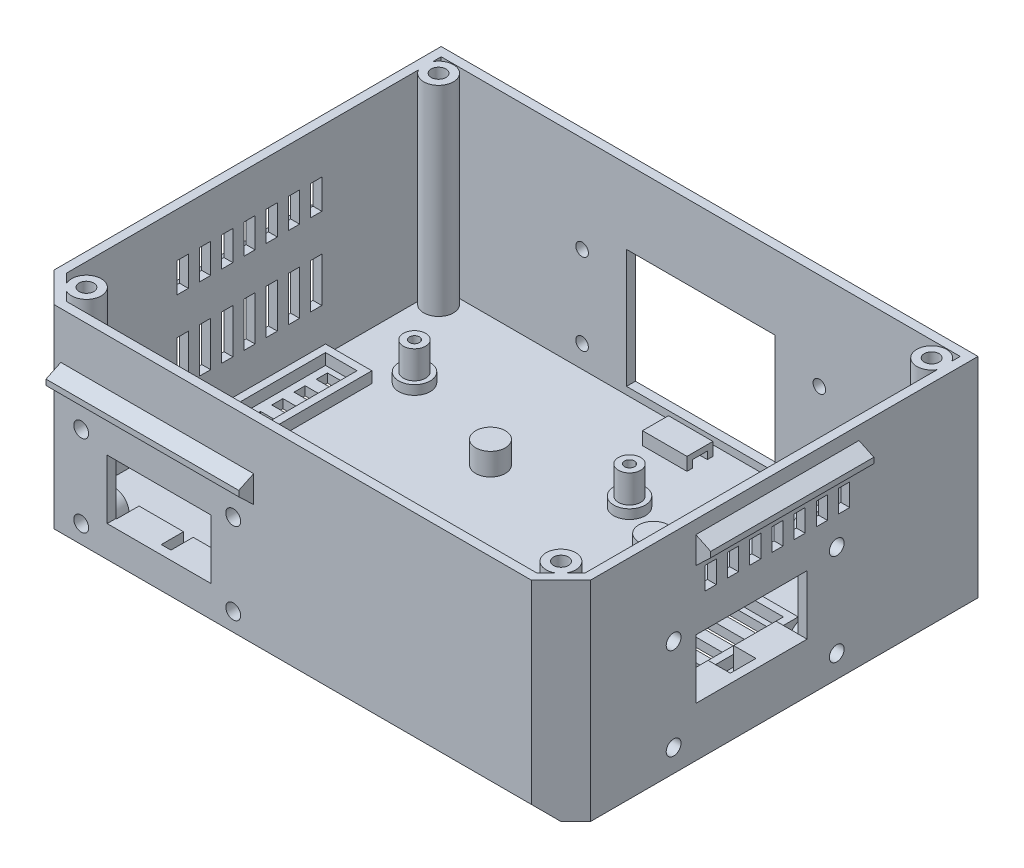
from build123d import *

# Parameters (mm, degrees)
BOX_BLOCK_DEPTH                     = 56.4
REAR_BOTTOM_FACET_DEPTH             = 147.709508894
REAR_BOTTOM_FACET_DEPTH_BACK        = 147.709508894
SHELL_T                             = -2.4
SKETCH3_R                           = 1.7
SKETCH3_W                           = 40
SKETCH3_H                           = 32
CABLE_WINDOW_AND_FLANGE_HOLES_DEPTH = 3.4
SKETCH4_R                           = 3
PI_STANDOFFS_DEPTH                  = 10.5
SKETCH5_R                           = 4.25
PI_STANDOFF_BASES_DEPTH             = 3
SKETCH6_R                           = 1.35
PI_SCREW_HOLES_DEPTH                = 13.4
SKETCH7_R                           = 2.75
PI_COUNTERBORES_DEPTH               = 2.7
SKETCH8_R                           = 4
LID_BOSS_1_DEPTH                    = 54.5
SKETCH9_R                           = 4
LID_BOSS_2_DEPTH                    = 54.5
SKETCH10_R                          = 4
LID_BOSS_3_DEPTH                    = 54.5
SKETCH11_R                          = 4
LID_BOSS_4_DEPTH                    = 54.5
SKETCH12_R                          = 2
LID_INSERT_HOLES_DEPTH              = 6.5
SKETCH13_W                          = 20
SKETCH13_H                          = 40
SKETCH13_W_2                        = 16
SKETCH13_H_2                        = 36
INTAKE_UPSTAND_DEPTH                = 3.5
SKETCH14_W                          = 12
SKETCH14_H                          = 3
INTAKE_SLOTS_DEPTH                  = 3.9
SKETCH15_W                          = 12.5
SKETCH15_H                          = 40
SKETCH15_W_2                        = 8.5
SKETCH15_H_2                        = 36
FLOOR_EXHAUST_UPSTAND_DEPTH         = 3.5
SKETCH16_W                          = 4.5
SKETCH16_H                          = 3
FLOOR_EXHAUST_SLOTS_DEPTH           = 3.9
SKETCH17_W                          = 3
SKETCH17_H                          = 12
EXHAUST_VENTS_DEPTH                 = 3.4
EXHAUST_DRIP_LEDGE_DEPTH            = 44
SKETCH19_W                          = 3
SKETCH19_H                          = 8
UPPER_VENTS_L_DEPTH                 = 3.4
UPPER_DRIP_LEDGE_L_DEPTH            = 44
SKETCH21_W                          = 3
SKETCH21_H                          = 6
UPPER_VENTS_R_DEPTH                 = 3.4
UPPER_DRIP_LEDGE_R_DEPTH            = 44
SKETCH23_W                          = 28
SKETCH23_H                          = 16
REAR_PORT_OPENING_DEPTH             = 3.4
SKETCH24_R                          = 4
REAR_PORT_BOSSES_DEPTH              = 6.6
SKETCH25_W                          = 8
SKETCH25_H                          = 7
REAR_PORT_BOSS_ROOTS_DEPTH          = 6.6
REAR_BOSS_GUSSET_57_DEPTH           = 8
REAR_BOSS_GUSSET_16_DEPTH           = 8
SKETCH28_R                          = 2
REAR_PORT_INSERT_HOLES_DEPTH        = 7
REAR_PORT_DRIP_LEDGE_DEPTH          = 52
SKETCH30_W                          = 12
SKETCH30_H                          = 6.1
REAR_TIE_BLOCK_USBC_DEPTH           = 10.5
SKETCH31_W                          = 3
SKETCH31_H                          = 2
REAR_TIE_TUNNEL_USBC_DEPTH          = 14
SKETCH32_W                          = 12
SKETCH32_H                          = 6.1
REAR_TIE_BLOCK_HDMI_DEPTH           = 10.5
SKETCH33_W                          = 3
SKETCH33_H                          = 2
REAR_TIE_TUNNEL_HDMI_DEPTH          = 14
SKETCH34_W                          = 30
SKETCH34_H                          = 16
SIDE_PORT_OPENING_DEPTH             = 3.4
SKETCH35_R                          = 4
SIDE_PORT_BOSSES_DEPTH              = 6.6
SIDE_BOSS_GUSSET_94_DEPTH           = 8
SIDE_BOSS_GUSSET_50_DEPTH           = 8
SKETCH38_R                          = 2
SIDE_PORT_INSERT_HOLES_DEPTH        = 7
SKETCH39_W                          = 6.1
SKETCH39_H                          = 11.7
SIDE_TIE_BLOCK_ETH_DEPTH            = 11.5
SKETCH40_W                          = 3
SKETCH40_H                          = 2
SIDE_TIE_TUNNEL_ETH_DEPTH           = 14
SKETCH41_W                          = 6.1
SKETCH41_H                          = 11.4
SIDE_TIE_BLOCK_USBA_DEPTH           = 11.5
SKETCH42_W                          = 3
SKETCH42_H                          = 2
SIDE_TIE_TUNNEL_USBA_DEPTH          = 14
SKETCH43_W                          = 12
SKETCH43_H                          = 7
BUNDLE_TIE_ANCHOR_DEPTH             = 4
SKETCH44_W                          = 4
SKETCH44_H                          = 2
BUNDLE_TIE_SLOT_DEPTH               = 14
SKETCH45_R                          = 4
RAIL_PLATE_BOSSES_DEPTH             = 6.5
SKETCH46_R                          = 2
RAIL_INSERT_HOLES_DEPTH             = 6.5


with BuildPart() as part:
    # Sketch1 → Box Block (new body)
    with BuildSketch(Plane(origin=(0, -28.4, 0), x_dir=(1, 0, 0), z_dir=(0, 1, 0))):
        Polygon((-64.4, -124.4), (64.4, -124.4), (72.4, -116.4), (72.4, -11.9), (-72.4, -11.9), (-72.4, -116.4), align=None)
    extrude(amount=BOX_BLOCK_DEPTH)

    # Sketch2 → Rear Bottom Facet (cut, two sides: drawn at the far end of the back side and taken through both)
    with BuildSketch(Plane(origin=(0, 0, 0), x_dir=(0, 0, -1), z_dir=(1, 0, 0)).offset(-REAR_BOTTOM_FACET_DEPTH_BACK)):
        Polygon((-125.4, -23.4), (-119.4, -29.4), (-125.4, -29.4), align=None)
    extrude(amount=REAR_BOTTOM_FACET_DEPTH + REAR_BOTTOM_FACET_DEPTH_BACK, mode=Mode.SUBTRACT)

    # Shell
    shell_openings = [part.faces().sort_by_distance(p)[0] for p in [
        (0, 28, 67.938651958),
    ]]
    offset(amount=SHELL_T, openings=shell_openings, kind=Kind.INTERSECTION)

    # Sketch3 → Cable Window and Flange Holes (cut)
    with BuildSketch(Plane.XY.offset(11.4)):
        with Locations((-32, 2)):
            Circle(SKETCH3_R)
        with Locations((32, 2)):
            Circle(SKETCH3_R)
        with Locations((-32, -20)):
            Circle(SKETCH3_R)
        with Locations((32, -20)):
            Circle(SKETCH3_R)
        with Locations((0, -8)):
            Rectangle(SKETCH3_W, SKETCH3_H)
    extrude(amount=CABLE_WINDOW_AND_FLANGE_HOLES_DEPTH, mode=Mode.SUBTRACT)

    # Sketch4 → Pi Standoffs (add)
    with BuildSketch(Plane(origin=(0, -26.5, 0), x_dir=(1, 0, 0), z_dir=(0, 1, 0))):
        with Locations((-51.5, -89)):
            Circle(SKETCH4_R)
        with Locations((6.5, -89)):
            Circle(SKETCH4_R)
        with Locations((-51.5, -40)):
            Circle(SKETCH4_R)
        with Locations((6.5, -40)):
            Circle(SKETCH4_R)
    extrude(amount=PI_STANDOFFS_DEPTH)

    # Sketch5 → Pi Standoff Bases (add)
    with BuildSketch(Plane(origin=(0, -26.5, 0), x_dir=(1, 0, 0), z_dir=(0, 1, 0))):
        with Locations((-51.5, -89)):
            Circle(SKETCH5_R)
        with Locations((6.5, -89)):
            Circle(SKETCH5_R)
        with Locations((-51.5, -40)):
            Circle(SKETCH5_R)
        with Locations((6.5, -40)):
            Circle(SKETCH5_R)
    extrude(amount=PI_STANDOFF_BASES_DEPTH)

    # Sketch6 → Pi Screw Holes (cut)
    with BuildSketch(Plane(origin=(0, -28.9, 0), x_dir=(1, 0, 0), z_dir=(0, 1, 0))):
        with Locations((-51.5, -89)):
            Circle(SKETCH6_R)
        with Locations((6.5, -89)):
            Circle(SKETCH6_R)
        with Locations((-51.5, -40)):
            Circle(SKETCH6_R)
        with Locations((6.5, -40)):
            Circle(SKETCH6_R)
    extrude(amount=PI_SCREW_HOLES_DEPTH, mode=Mode.SUBTRACT)

    # Sketch7 → Pi Counterbores (cut)
    with BuildSketch(Plane(origin=(0, -28.9, 0), x_dir=(1, 0, 0), z_dir=(0, 1, 0))):
        with Locations((-51.5, -89)):
            Circle(SKETCH7_R)
        with Locations((6.5, -89)):
            Circle(SKETCH7_R)
        with Locations((-51.5, -40)):
            Circle(SKETCH7_R)
        with Locations((6.5, -40)):
            Circle(SKETCH7_R)
    extrude(amount=PI_COUNTERBORES_DEPTH, mode=Mode.SUBTRACT)

    # Sketch8 → Lid Boss 1 (add)
    with BuildSketch(Plane(origin=(0, -26.5, 0), x_dir=(1, 0, 0), z_dir=(0, 1, 0))):
        with Locations((-66.5, -18.5)):
            Circle(SKETCH8_R)
    extrude(amount=LID_BOSS_1_DEPTH)

    # Sketch9 → Lid Boss 2 (add)
    with BuildSketch(Plane(origin=(0, -26.5, 0), x_dir=(1, 0, 0), z_dir=(0, 1, 0))):
        with Locations((66.5, -18.5)):
            Circle(SKETCH9_R)
    extrude(amount=LID_BOSS_2_DEPTH)

    # Sketch10 → Lid Boss 3 (add)
    with BuildSketch(Plane(origin=(0, -26.5, 0), x_dir=(1, 0, 0), z_dir=(0, 1, 0))):
        with Locations((-64, -116)):
            Circle(SKETCH10_R)
    extrude(amount=LID_BOSS_3_DEPTH)

    # Sketch11 → Lid Boss 4 (add)
    with BuildSketch(Plane(origin=(0, -26.5, 0), x_dir=(1, 0, 0), z_dir=(0, 1, 0))):
        with Locations((64, -116)):
            Circle(SKETCH11_R)
    extrude(amount=LID_BOSS_4_DEPTH)

    # Sketch12 → Lid Insert Holes (cut)
    with BuildSketch(Plane(origin=(0, 22, 0), x_dir=(1, 0, 0), z_dir=(0, 1, 0))):
        with Locations((-66.5, -18.5)):
            Circle(SKETCH12_R)
        with Locations((66.5, -18.5)):
            Circle(SKETCH12_R)
        with Locations((-64, -116)):
            Circle(SKETCH12_R)
        with Locations((64, -116)):
            Circle(SKETCH12_R)
    extrude(amount=LID_INSERT_HOLES_DEPTH, mode=Mode.SUBTRACT)

    # Sketch13 → Intake Upstand (add)
    with BuildSketch(Plane(origin=(0, -26.5, 0), x_dir=(1, 0, 0), z_dir=(0, 1, 0))):
        with Locations((48, -66)):
            Rectangle(SKETCH13_W, SKETCH13_H)
        with Locations((48, -66)):
            Rectangle(SKETCH13_W_2, SKETCH13_H_2, mode=Mode.SUBTRACT)
    extrude(amount=INTAKE_UPSTAND_DEPTH)

    # Sketch14 → Intake Slots (cut)
    with BuildSketch(Plane(origin=(0, -29.4, 0), x_dir=(1, 0, 0), z_dir=(0, 1, 0))):
        with Locations((48, -81)):
            Rectangle(SKETCH14_W, SKETCH14_H)
        with Locations((48, -75)):
            Rectangle(SKETCH14_W, SKETCH14_H)
        with Locations((48, -69)):
            Rectangle(SKETCH14_W, SKETCH14_H)
        with Locations((48, -63)):
            Rectangle(SKETCH14_W, SKETCH14_H)
        with Locations((48, -57)):
            Rectangle(SKETCH14_W, SKETCH14_H)
        with Locations((48, -51)):
            Rectangle(SKETCH14_W, SKETCH14_H)
    extrude(amount=INTAKE_SLOTS_DEPTH, mode=Mode.SUBTRACT)

    # Sketch15 → Floor Exhaust Upstand (add)
    with BuildSketch(Plane(origin=(0, -26.5, 0), x_dir=(1, 0, 0), z_dir=(0, 1, 0))):
        with Locations((-63.25, -66)):
            Rectangle(SKETCH15_W, SKETCH15_H)
        with Locations((-63.25, -66)):
            Rectangle(SKETCH15_W_2, SKETCH15_H_2, mode=Mode.SUBTRACT)
    extrude(amount=FLOOR_EXHAUST_UPSTAND_DEPTH)

    # Sketch16 → Floor Exhaust Slots (cut)
    with BuildSketch(Plane(origin=(0, -29.4, 0), x_dir=(1, 0, 0), z_dir=(0, 1, 0))):
        with Locations((-63.25, -81)):
            Rectangle(SKETCH16_W, SKETCH16_H)
        with Locations((-63.25, -75)):
            Rectangle(SKETCH16_W, SKETCH16_H)
        with Locations((-63.25, -69)):
            Rectangle(SKETCH16_W, SKETCH16_H)
        with Locations((-63.25, -63)):
            Rectangle(SKETCH16_W, SKETCH16_H)
        with Locations((-63.25, -57)):
            Rectangle(SKETCH16_W, SKETCH16_H)
        with Locations((-63.25, -51)):
            Rectangle(SKETCH16_W, SKETCH16_H)
    extrude(amount=FLOOR_EXHAUST_SLOTS_DEPTH, mode=Mode.SUBTRACT)

    # Sketch17 → Exhaust Vents (cut)
    with BuildSketch(Plane(origin=(-72.9, 0, 0), x_dir=(0, 0, -1), z_dir=(1, 0, 0))):
        with Locations((-84, -8)):
            Rectangle(SKETCH17_W, SKETCH17_H)
        with Locations((-78, -8)):
            Rectangle(SKETCH17_W, SKETCH17_H)
        with Locations((-72, -8)):
            Rectangle(SKETCH17_W, SKETCH17_H)
        with Locations((-66, -8)):
            Rectangle(SKETCH17_W, SKETCH17_H)
        with Locations((-60, -8)):
            Rectangle(SKETCH17_W, SKETCH17_H)
        with Locations((-54, -8)):
            Rectangle(SKETCH17_W, SKETCH17_H)
        with Locations((-48, -8)):
            Rectangle(SKETCH17_W, SKETCH17_H)
    extrude(amount=EXHAUST_VENTS_DEPTH, mode=Mode.SUBTRACT)

    # Sketch18 → Exhaust Drip Ledge (add)
    with BuildSketch(Plane.XY.offset(44)):
        Polygon((-72.2, -0.5), (-76.4, 3.5), (-76.4, 5), (-72.2, 7), align=None)
    extrude(amount=EXHAUST_DRIP_LEDGE_DEPTH)

    # Sketch19 → Upper Vents L (cut)
    with BuildSketch(Plane(origin=(-72.9, 0, 0), x_dir=(0, 0, -1), z_dir=(1, 0, 0))):
        with Locations((-84, 12)):
            Rectangle(SKETCH19_W, SKETCH19_H)
        with Locations((-78, 12)):
            Rectangle(SKETCH19_W, SKETCH19_H)
        with Locations((-72, 12)):
            Rectangle(SKETCH19_W, SKETCH19_H)
        with Locations((-66, 12)):
            Rectangle(SKETCH19_W, SKETCH19_H)
        with Locations((-60, 12)):
            Rectangle(SKETCH19_W, SKETCH19_H)
        with Locations((-54, 12)):
            Rectangle(SKETCH19_W, SKETCH19_H)
        with Locations((-48, 12)):
            Rectangle(SKETCH19_W, SKETCH19_H)
    extrude(amount=UPPER_VENTS_L_DEPTH, mode=Mode.SUBTRACT)

    # Sketch20 → Upper Drip Ledge L (add)
    with BuildSketch(Plane.XY.offset(44)):
        Polygon((-72.2, 17), (-76.4, 21), (-76.4, 22.5), (-72.2, 24.5), align=None)
    extrude(amount=UPPER_DRIP_LEDGE_L_DEPTH)

    # Sketch21 → Upper Vents R (cut)
    with BuildSketch(Plane(origin=(69.5, 0, 0), x_dir=(0, 0, -1), z_dir=(1, 0, 0))):
        with Locations((-84, 13)):
            Rectangle(SKETCH21_W, SKETCH21_H)
        with Locations((-78, 13)):
            Rectangle(SKETCH21_W, SKETCH21_H)
        with Locations((-72, 13)):
            Rectangle(SKETCH21_W, SKETCH21_H)
        with Locations((-66, 13)):
            Rectangle(SKETCH21_W, SKETCH21_H)
        with Locations((-60, 13)):
            Rectangle(SKETCH21_W, SKETCH21_H)
        with Locations((-54, 13)):
            Rectangle(SKETCH21_W, SKETCH21_H)
        with Locations((-48, 13)):
            Rectangle(SKETCH21_W, SKETCH21_H)
    extrude(amount=UPPER_VENTS_R_DEPTH, mode=Mode.SUBTRACT)

    # Sketch22 → Upper Drip Ledge R (add)
    with BuildSketch(Plane.XY.offset(44)):
        Polygon((72.2, 17), (76.4, 21), (76.4, 22.5), (72.2, 24.5), align=None)
    extrude(amount=UPPER_DRIP_LEDGE_R_DEPTH)

    # Sketch23 → Rear Port Opening (cut)
    with BuildSketch(Plane.XY.offset(121.5)):
        with Locations((-36, -8)):
            Rectangle(SKETCH23_W, SKETCH23_H)
    extrude(amount=REAR_PORT_OPENING_DEPTH, mode=Mode.SUBTRACT)

    # Sketch24 → Rear Port Bosses (add)
    with BuildSketch(Plane.XY.offset(115.5)):
        with Locations((-57, -19.5)):
            Circle(SKETCH24_R)
        with Locations((-57, 2.5)):
            Circle(SKETCH24_R)
        with Locations((-16, -19.5)):
            Circle(SKETCH24_R)
        with Locations((-16, 2.5)):
            Circle(SKETCH24_R)
    extrude(amount=REAR_PORT_BOSSES_DEPTH)

    # Sketch25 → Rear Port Boss Roots (add)
    with BuildSketch(Plane.XY.offset(115.5)):
        with Locations((-57, -23)):
            Rectangle(SKETCH25_W, SKETCH25_H)
        with Locations((-16, -23)):
            Rectangle(SKETCH25_W, SKETCH25_H)
    extrude(amount=REAR_PORT_BOSS_ROOTS_DEPTH)

    # Sketch26 → Rear Boss Gusset -57 (add)
    with BuildSketch(Plane(origin=(-61, 0, 0), x_dir=(0, 0, -1), z_dir=(1, 0, 0))):
        Polygon((-122.1, 2.5), (-115.5, 2.5), (-115.5, -1.5), (-122.1, -8.1), align=None)
    extrude(amount=REAR_BOSS_GUSSET_57_DEPTH)

    # Sketch27 → Rear Boss Gusset -16 (add)
    with BuildSketch(Plane(origin=(-20, 0, 0), x_dir=(0, 0, -1), z_dir=(1, 0, 0))):
        Polygon((-122.1, 2.5), (-115.5, 2.5), (-115.5, -1.5), (-122.1, -8.1), align=None)
    extrude(amount=REAR_BOSS_GUSSET_16_DEPTH)

    # Sketch28 → Rear Port Insert Holes (cut)
    with BuildSketch(Plane.XY.offset(117.9)):
        with Locations((-57, -19.5)):
            Circle(SKETCH28_R)
        with Locations((-57, 2.5)):
            Circle(SKETCH28_R)
        with Locations((-16, -19.5)):
            Circle(SKETCH28_R)
        with Locations((-16, 2.5)):
            Circle(SKETCH28_R)
    extrude(amount=REAR_PORT_INSERT_HOLES_DEPTH, mode=Mode.SUBTRACT)

    # Sketch29 → Rear Port Drip Ledge (add)
    with BuildSketch(Plane(origin=(-62.5, 0, 0), x_dir=(0, 0, -1), z_dir=(1, 0, 0))):
        Polygon((-124.2, 8), (-128.4, 12), (-128.4, 13.5), (-124.2, 15.5), align=None)
    extrude(amount=REAR_PORT_DRIP_LEDGE_DEPTH)

    # Sketch30 → Rear Tie Block usbc (add)
    with BuildSketch(Plane(origin=(0, -26.5, 0), x_dir=(1, 0, 0), z_dir=(0, 1, 0))):
        with Locations((-43.8, -119.05)):
            Rectangle(SKETCH30_W, SKETCH30_H)
    extrude(amount=REAR_TIE_BLOCK_USBC_DEPTH)

    # Sketch31 → Rear Tie Tunnel usbc (cut)
    with BuildSketch(Plane(origin=(-50.8, 0, 0), x_dir=(0, 0, -1), z_dir=(1, 0, 0))):
        with Locations((-119, -23.5)):
            Rectangle(SKETCH31_W, SKETCH31_H)
    extrude(amount=REAR_TIE_TUNNEL_USBC_DEPTH, mode=Mode.SUBTRACT)

    # Sketch32 → Rear Tie Block hdmi (add)
    with BuildSketch(Plane(origin=(0, -26.5, 0), x_dir=(1, 0, 0), z_dir=(0, 1, 0))):
        with Locations((-29.2, -119.05)):
            Rectangle(SKETCH32_W, SKETCH32_H)
    extrude(amount=REAR_TIE_BLOCK_HDMI_DEPTH)

    # Sketch33 → Rear Tie Tunnel hdmi (cut)
    with BuildSketch(Plane(origin=(-36.2, 0, 0), x_dir=(0, 0, -1), z_dir=(1, 0, 0))):
        with Locations((-119, -23.5)):
            Rectangle(SKETCH33_W, SKETCH33_H)
    extrude(amount=REAR_TIE_TUNNEL_HDMI_DEPTH, mode=Mode.SUBTRACT)

    # Sketch34 → Side Port Opening (cut)
    with BuildSketch(Plane(origin=(69.5, 0, 0), x_dir=(0, 0, -1), z_dir=(1, 0, 0))):
        with Locations((-73, -7)):
            Rectangle(SKETCH34_W, SKETCH34_H)
    extrude(amount=SIDE_PORT_OPENING_DEPTH, mode=Mode.SUBTRACT)

    # Sketch35 → Side Port Bosses (add)
    with BuildSketch(Plane(origin=(63.5, 0, 0), x_dir=(0, 0, -1), z_dir=(1, 0, 0))):
        with Locations((-94, -22.3)):
            Circle(SKETCH35_R)
        with Locations((-94, 2.5)):
            Circle(SKETCH35_R)
        with Locations((-50, -22.3)):
            Circle(SKETCH35_R)
        with Locations((-50, 2.5)):
            Circle(SKETCH35_R)
    extrude(amount=SIDE_PORT_BOSSES_DEPTH)

    # Sketch36 → Side Boss Gusset -94 (add)
    with BuildSketch(Plane.XY.offset(90)):
        Polygon((70.1, 2.5), (63.5, 2.5), (63.5, -1.5), (70.1, -8.1), align=None)
    extrude(amount=SIDE_BOSS_GUSSET_94_DEPTH)

    # Sketch37 → Side Boss Gusset -50 (add)
    with BuildSketch(Plane.XY.offset(46)):
        Polygon((70.1, 2.5), (63.5, 2.5), (63.5, -1.5), (70.1, -8.1), align=None)
    extrude(amount=SIDE_BOSS_GUSSET_50_DEPTH)

    # Sketch38 → Side Port Insert Holes (cut)
    with BuildSketch(Plane(origin=(65.9, 0, 0), x_dir=(0, 0, -1), z_dir=(1, 0, 0))):
        with Locations((-94, -22.3)):
            Circle(SKETCH38_R)
        with Locations((-94, 2.5)):
            Circle(SKETCH38_R)
        with Locations((-50, -22.3)):
            Circle(SKETCH38_R)
        with Locations((-50, 2.5)):
            Circle(SKETCH38_R)
    extrude(amount=SIDE_PORT_INSERT_HOLES_DEPTH, mode=Mode.SUBTRACT)

    # Sketch39 → Side Tie Block eth (add)
    with BuildSketch(Plane(origin=(0, -26.5, 0), x_dir=(1, 0, 0), z_dir=(0, 1, 0))):
        with Locations((67.05, -82.15)):
            Rectangle(SKETCH39_W, SKETCH39_H)
    extrude(amount=SIDE_TIE_BLOCK_ETH_DEPTH)

    # Sketch40 → Side Tie Tunnel eth (cut)
    with BuildSketch(Plane.XY.offset(75.3)):
        with Locations((67, -23.5)):
            Rectangle(SKETCH40_W, SKETCH40_H)
    extrude(amount=SIDE_TIE_TUNNEL_ETH_DEPTH, mode=Mode.SUBTRACT)

    # Sketch41 → Side Tie Block usba (add)
    with BuildSketch(Plane(origin=(0, -26.5, 0), x_dir=(1, 0, 0), z_dir=(0, 1, 0))):
        with Locations((67.05, -63.7)):
            Rectangle(SKETCH41_W, SKETCH41_H)
    extrude(amount=SIDE_TIE_BLOCK_USBA_DEPTH)

    # Sketch42 → Side Tie Tunnel usba (cut)
    with BuildSketch(Plane.XY.offset(56.4)):
        with Locations((67, -23.5)):
            Rectangle(SKETCH42_W, SKETCH42_H)
    extrude(amount=SIDE_TIE_TUNNEL_USBA_DEPTH, mode=Mode.SUBTRACT)

    # Sketch43 → Bundle Tie Anchor (add)
    with BuildSketch(Plane(origin=(0, -26.5, 0), x_dir=(1, 0, 0), z_dir=(0, 1, 0))):
        with Locations((0, -20.5)):
            Rectangle(SKETCH43_W, SKETCH43_H)
    extrude(amount=BUNDLE_TIE_ANCHOR_DEPTH)

    # Sketch44 → Bundle Tie Slot (cut)
    with BuildSketch(Plane(origin=(-7, 0, 0), x_dir=(0, 0, -1), z_dir=(1, 0, 0))):
        with Locations((-20.5, -25)):
            Rectangle(SKETCH44_W, SKETCH44_H)
    extrude(amount=BUNDLE_TIE_SLOT_DEPTH, mode=Mode.SUBTRACT)

    # Sketch45 → Rail Plate Bosses (add)
    with BuildSketch(Plane(origin=(0, -26.5, 0), x_dir=(1, 0, 0), z_dir=(0, 1, 0))):
        with Locations((-22, -91)):
            Circle(SKETCH45_R)
        with Locations((-22, -49)):
            Circle(SKETCH45_R)
        with Locations((22, -91)):
            Circle(SKETCH45_R)
        with Locations((22, -49)):
            Circle(SKETCH45_R)
    extrude(amount=RAIL_PLATE_BOSSES_DEPTH)

    # Sketch46 → Rail Insert Holes (cut)
    with BuildSketch(Plane(origin=(0, -28.9, 0), x_dir=(1, 0, 0), z_dir=(0, 1, 0))):
        with Locations((-22, -91)):
            Circle(SKETCH46_R)
        with Locations((-22, -49)):
            Circle(SKETCH46_R)
        with Locations((22, -91)):
            Circle(SKETCH46_R)
        with Locations((22, -49)):
            Circle(SKETCH46_R)
    extrude(amount=RAIL_INSERT_HOLES_DEPTH, mode=Mode.SUBTRACT)


solid = part.part
